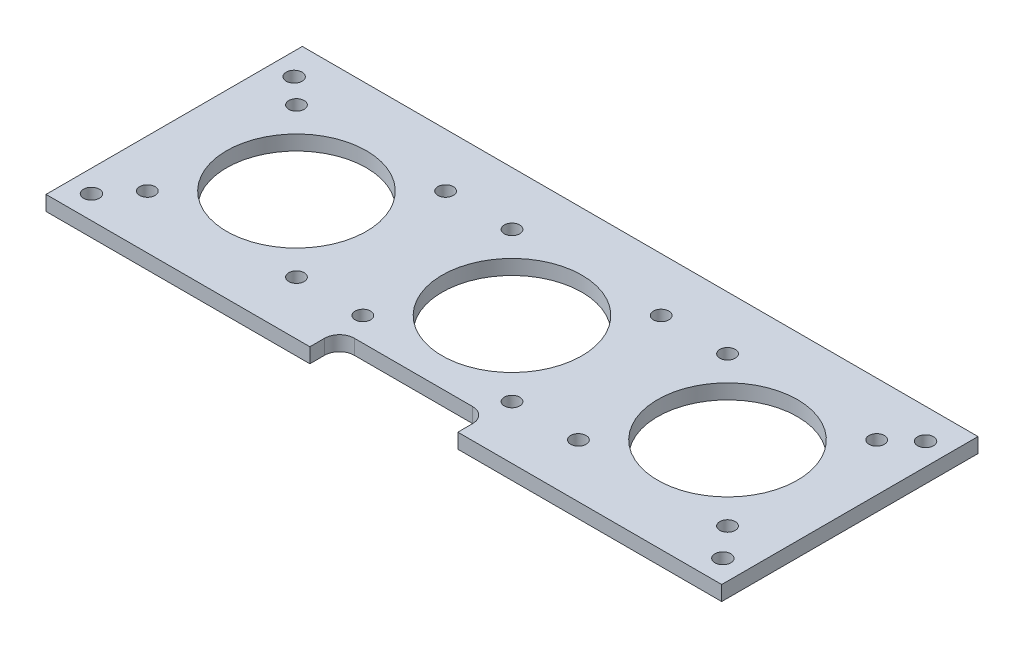
from build123d import *

# Parameters (mm, degrees)
SKETCH1_W           = 145
SKETCH1_H           = 55
BOSS_EXTRUDE1_DEPTH = 3.175
SKETCH4_R           = 1.651
SKETCH4_R_2         = 15
SKETCH4_R_3         = 1.69999914
CUT_EXTRUDE1_DEPTH  = 156.113122027


with BuildPart() as part:
    # Sketch1 → Boss-Extrude1 (new body)
    with BuildSketch(Plane(origin=(0, 0, 0), x_dir=(1, 0, 0), z_dir=(0, 1, 0))):
        with Locations((72.5, 27.5)):
            Rectangle(SKETCH1_W, SKETCH1_H)
    extrude(amount=BOSS_EXTRUDE1_DEPTH)

    # Sketch4 → Cut-Extrude1 (cut, through all)
    with BuildSketch(Plane.XZ):
        with Locations((10.25, -11.5)):
            Circle(SKETCH4_R)
        with Locations((10.25, -43.5)):
            Circle(SKETCH4_R)
        with Locations((42.25, -43.5)):
            Circle(SKETCH4_R)
        with Locations((26.25, -27.5)):
            Circle(SKETCH4_R_2)
        with Locations((42.25, -11.5)):
            Circle(SKETCH4_R)
        with Locations((56.5, -11.5)):
            Circle(SKETCH4_R)
        with Locations((56.5, -43.5)):
            Circle(SKETCH4_R)
        with Locations((88.5, -43.5)):
            Circle(SKETCH4_R)
        with Locations((88.5, -11.5)):
            Circle(SKETCH4_R)
        with Locations((72.5, -27.5)):
            Circle(SKETCH4_R_2)
        with Locations((102.75, -11.5)):
            Circle(SKETCH4_R)
        with Locations((102.75, -43.5)):
            Circle(SKETCH4_R)
        with Locations((134.75, -43.5)):
            Circle(SKETCH4_R)
        with Locations((134.75, -11.5)):
            Circle(SKETCH4_R)
        with Locations((118.75, -27.5)):
            Circle(SKETCH4_R_2)
        with Locations((4.749998796, -5.00000808)):
            Circle(SKETCH4_R_3)
        with Locations((4.750000369, -48.50000744)):
            Circle(SKETCH4_R_3)
        with Locations((140.249999576, -5.00000318)):
            Circle(SKETCH4_R_3)
        with Locations((140.250001149, -48.50000254)):
            Circle(SKETCH4_R_3)
        with BuildLine():
            Line((85.2, -6.35), (59.8, -6.35))
            ThreePointArc((59.8, -6.35), (57.55493597, -5.42006403), (56.625, -3.175))
            Line((56.625, -3.175), (56.625, 0))
            Line((56.625, 0), (88.375, 0))
            Line((88.375, 0), (88.375, -3.175))
            ThreePointArc((88.375, -3.175), (87.44506403, -5.42006403), (85.2, -6.35))
        make_face()
    extrude(amount=-CUT_EXTRUDE1_DEPTH, mode=Mode.SUBTRACT)


solid = part.part
